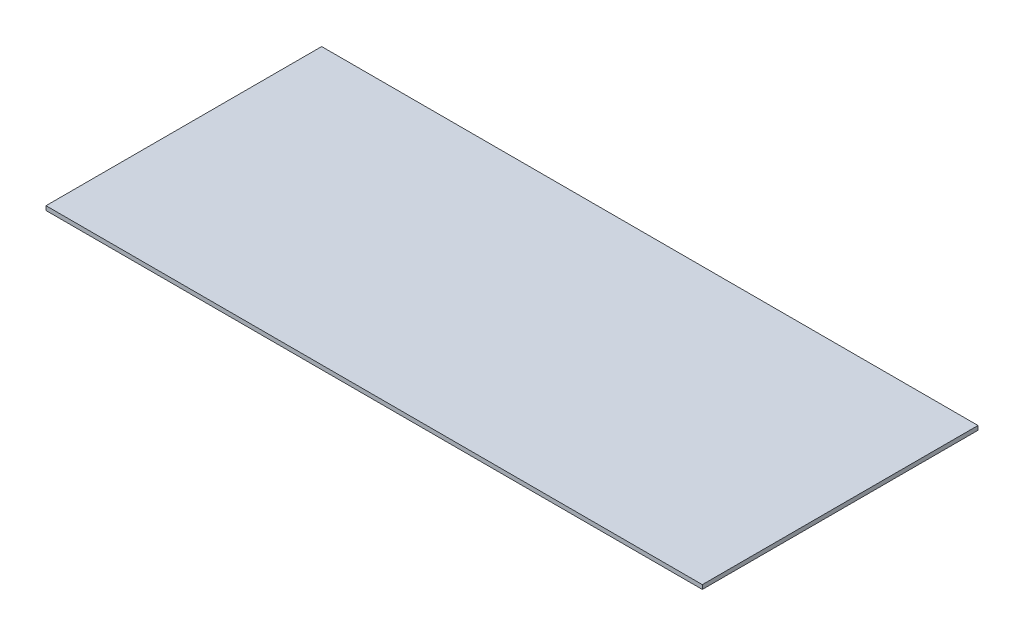
from build123d import *

# Parameters (mm, degrees)
ESQUISSE1_W        = 2500
ESQUISSE1_H        = 1050
BOSS_EXTRU_1_DEPTH = 16


with BuildPart() as part:
    # Esquisse1 → Boss.-Extru.1 (new body)
    with BuildSketch(Plane(origin=(0, 0, 0), x_dir=(1, 0, 0), z_dir=(0, 1, 0))):
        with Locations((1250, 525)):
            Rectangle(ESQUISSE1_W, ESQUISSE1_H)
    extrude(amount=BOSS_EXTRU_1_DEPTH)


solid = part.part
